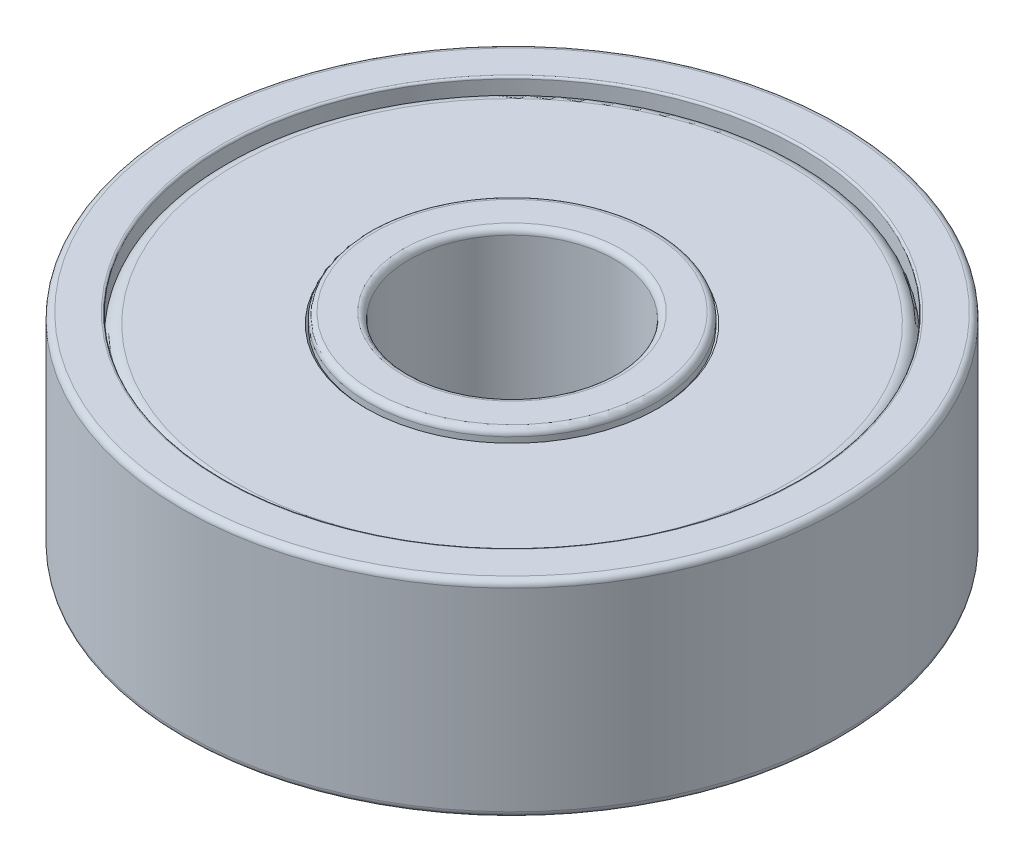
from build123d import *

# Parameters (mm, degrees)
SKETCH1_R             = 8
SKETCH1_R_2           = 7
BOSS_EXTRUDE1_DEPTH   = 2.5
SKETCH1_R_3           = 3.5
SKETCH1_R_4           = 2.5
BOSS_EXTRUDE1_2_DEPTH = 2.5
FILLET1_R             = 0.15
FILLET2_R             = 0.15
FILLET3_R             = 0.05
SKETCH2_R             = 7
SKETCH2_R_2           = 3.5
BOSS_EXTRUDE2_DEPTH   = 2.25
FILLET4_R             = 0.3
CHAMFER1_SIZE         = 0.05


with BuildPart() as part:
    # Sketch1 → Boss-Extrude1 (new, symmetric)
    with BuildSketch(Plane(origin=(0, 0, 0), x_dir=(1, 0, 0), z_dir=(0, 1, 0))):
        Circle(SKETCH1_R)
        Circle(SKETCH1_R_2, mode=Mode.SUBTRACT)
    extrude(amount=BOSS_EXTRUDE1_DEPTH, both=True)

    # Fillet2
    fillet2_edges = [part.edges().sort_by_distance(p)[0] for p in [
        (-8, -2.5, 0),
        (-8, 2.5, 0),
    ]]
    fillet(fillet2_edges, radius=FILLET2_R)

    # Fillet3
    fillet3_edges = [part.edges().sort_by_distance(p)[0] for p in [
        (-7, -2.5, 0),
        (-7, 2.5, 0),
    ]]
    fillet(fillet3_edges, radius=FILLET3_R)


with BuildPart() as body_2:
    # Sketch1 → Boss-Extrude1 2 (new, symmetric)
    with BuildSketch(Plane(origin=(0, 0, 0), x_dir=(1, 0, 0), z_dir=(0, 1, 0))):
        Circle(SKETCH1_R_3)
        Circle(SKETCH1_R_4, mode=Mode.SUBTRACT)
    extrude(amount=BOSS_EXTRUDE1_2_DEPTH, both=True)

    # Fillet1
    fillet1_edges = [body_2.edges().sort_by_distance(p)[0] for p in [
        (-2.5, -2.5, 0),
        (-2.5, 2.5, 0),
        (-3.5, -2.5, 0),
        (-3.5, 2.5, 0),
    ]]
    fillet(fillet1_edges, radius=FILLET1_R)


with BuildPart() as body_3:
    # Sketch2 → Boss-Extrude2 (new, symmetric)
    with BuildSketch(Plane(origin=(0, 0, 0), x_dir=(1, 0, 0), z_dir=(0, 1, 0))):
        Circle(SKETCH2_R)
        Circle(SKETCH2_R_2, mode=Mode.SUBTRACT)
    extrude(amount=BOSS_EXTRUDE2_DEPTH, both=True)

    # Fillet4
    fillet4_edges = [body_3.edges().sort_by_distance(p)[0] for p in [
        (-7, -2.25, 0),
        (-7, 2.25, 0),
    ]]
    fillet(fillet4_edges, radius=FILLET4_R)

    # Chamfer1
    chamfer1_edges = [body_3.edges().sort_by_distance(p)[0] for p in [
        (-3.5, -2.25, 0),
        (-3.5, 2.25, 0),
    ]]
    chamfer(chamfer1_edges, length=CHAMFER1_SIZE)


solid = Compound([part.part, body_2.part, body_3.part])
